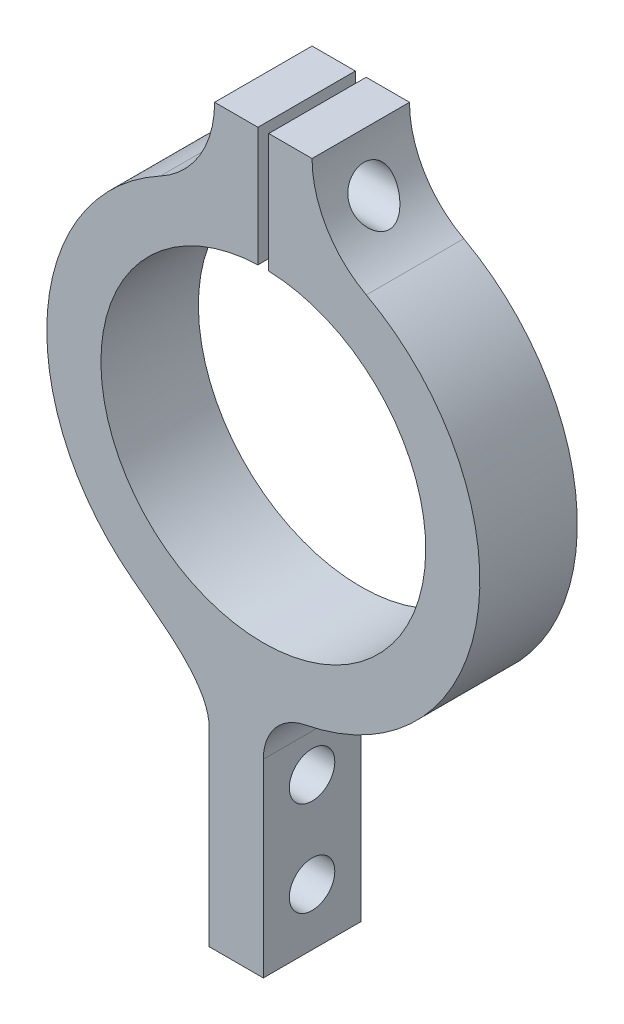
from build123d import *

# Parameters (mm, degrees)
BOSS_EXTRUDE1_DEPTH  = 18
SKETCH14_W           = 4.2
SKETCH14_H           = 39
M8_CLEARANCE_HOLE2_D = 8.4
M8_CLEARANCE_HOLE3_D = 8.4


with BuildPart() as part:
    # Sketch1 → Boss-Extrude1 (new body)
    with BuildSketch(Plane.XY):
        with BuildLine():
            Line((0, -48.600411521), (0, -83.600411521))
            Line((0, -83.600411521), (-10, -83.600411521))
            Line((-10, -83.600411521), (-10, -48.600411521))
            add(Edge.make_bspline(
                [(-26.535230031, -29.931280748), (-20.948212629, -34.88438627), (-10, -40.904022772), (-10, -48.600411521)],
                knots=[0, 0, 0, 0, 1, 1, 1, 1], degree=3))
            ThreePointArc((-26.535230031, -29.931280748), (-39.736468525, 4.584001436), (-19.02319236, 35.186903138))
            ThreePointArc((-19.02319236, 35.186903138), (-11.695932832, 42.212959957), (-9, 52))
            Line((-9, 52), (-1, 52))
            Line((-1, 52), (-1, 29.983328701))
            ThreePointArc((-1, 29.983328701), (0, -30), (1, 29.983328701))
            Line((1, 29.983328701), (1, 52))
            Line((1, 52), (9, 52))
            ThreePointArc((9, 52), (11.695932832, 42.212959957), (19.02319236, 35.186903138))
            ThreePointArc((19.02319236, 35.186903138), (39.54457484, -6.018853774), (7.693084301, -39.253234949))
            ThreePointArc((7.693084301, -39.253234949), (2.170592409, -42.547452411), (0, -48.600411521))
        make_face()
    extrude(amount=BOSS_EXTRUDE1_DEPTH)

    # Sketch14 → M8 Clearance Hole1 (revolve, cut)
    with BuildSketch(Plane(origin=(1, 43, 9), x_dir=(0, 0, 1), z_dir=(0, 1, 0))):
        with Locations((2.1, 19.5)):
            Rectangle(SKETCH14_W, SKETCH14_H)
    revolve(axis=Axis((-5.35, 43, 9), (1, 0, 0)), mode=Mode.SUBTRACT)

    # M8 Clearance Hole2 (through all)
    with Locations(Plane(origin=(1, 0, 0), x_dir=(0, 0, 1), z_dir=(1, 0, 0))):
        with Locations((9, -43)):
            Hole(M8_CLEARANCE_HOLE2_D / 2)

    # M8 Clearance Hole3 (through all)
    with Locations(Plane(origin=(0, 0, 0), x_dir=(0, 0, -1), z_dir=(1, 0, 0))):
        with Locations((-9, -55.600411521), (-9, -73.100411521)):
            Hole(M8_CLEARANCE_HOLE3_D / 2)


solid = part.part
